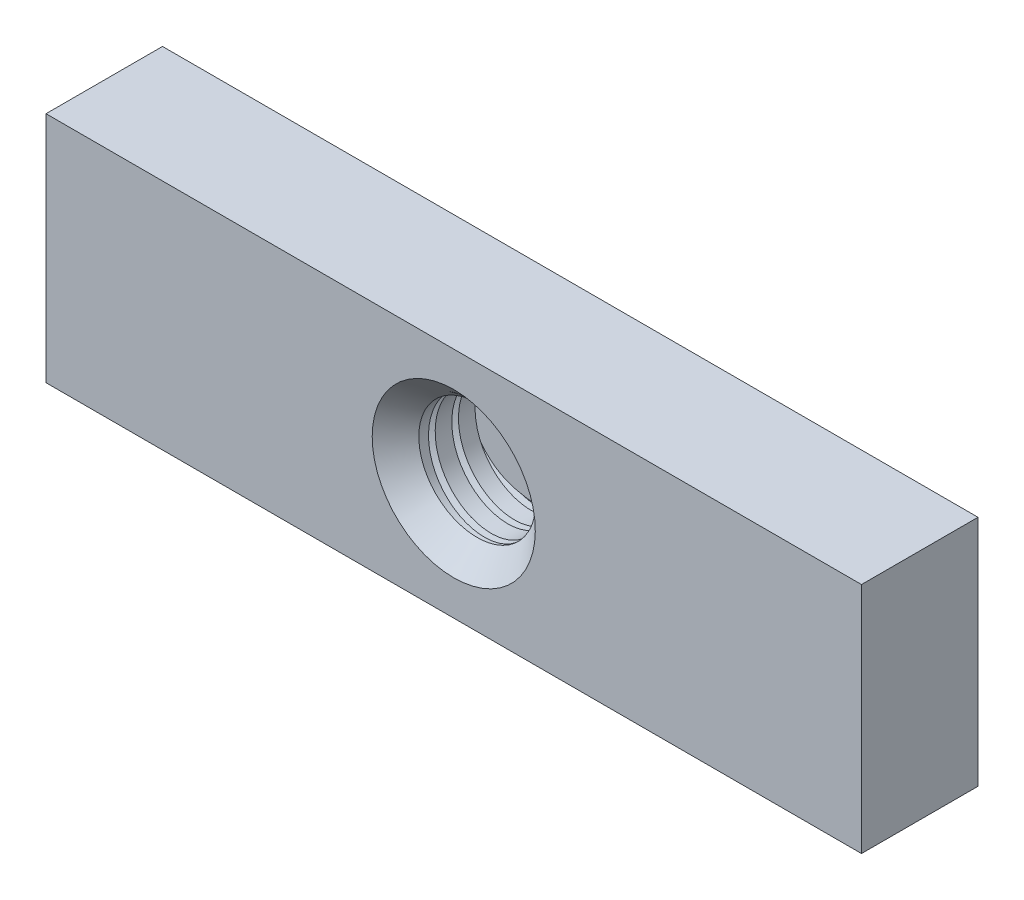
from build123d import *

# Parameters (mm, degrees)
SKETCH1_W           = 70
SKETCH1_H           = 20
SKETCH1_R           = 5
BOSS_EXTRUDE1_DEPTH = 7
CHAMFER1_SIZE       = 2
CUT_SWEEP2_PITCH    = 2
SKETCH4_W           = 70
SKETCH4_H           = 20
BOSS_EXTRUDE2_DEPTH = 3


with BuildPart() as part:
    # Sketch1 → Boss-Extrude1 (new body)
    with BuildSketch(Plane.XY):
        with Locations((35, 10)):
            Rectangle(SKETCH1_W, SKETCH1_H)
        with Locations((35, 10)):
            Circle(SKETCH1_R, mode=Mode.SUBTRACT)
    extrude(amount=BOSS_EXTRUDE1_DEPTH)

    # Chamfer1
    chamfer1_edges = [part.edges().sort_by_distance(p)[0] for p in [
        (30, 10, 7),
    ]]
    chamfer(chamfer1_edges, length=CHAMFER1_SIZE)

    # Cut-Sweep2: the profile of Sketch3 screwed along a right-hand helix of 7 turns, 10 arcs to a turn; built about Z, then put on its axis
    cut_sweep2_z = Axis((0, 0, 0), (0, 0, 1))
    cut_sweep2_corners = [(3.996838686, -0.020755165, 0.260817099), (5.496838686, -0.0894541, 1.124113373), (3.996838686, -0.158153035, 1.987409647)]
    with BuildLine(mode=Mode.PRIVATE) as cut_sweep2_profile:
        Line(cut_sweep2_corners[0], cut_sweep2_corners[1])
        Line(cut_sweep2_corners[1], cut_sweep2_corners[2])
        Line(cut_sweep2_corners[2], cut_sweep2_corners[0])
    cut_sweep2_cap = Face(cut_sweep2_profile.wire())
    cut_sweep2_turn_angles = [0, 18, 36, 54, 72, 90, 108, 126, 144, 162, 180, 198, 216, 234, 252, 270, 288, 306, 324, 342, 360]
    cut_sweep2_turn_weights = [1, 0.9510565162951535, 1, 0.9510565162951535, 1, 0.9510565162951535, 1, 0.9510565162951535, 1, 0.9510565162951535, 1, 0.9510565162951535, 1, 0.9510565162951535, 1, 0.9510565162951535, 1, 0.9510565162951535, 1, 0.9510565162951535, 1]
    cut_sweep2_turn_rails = [Edge.make_bspline([Vector(p[0], p[1], 0).rotate(cut_sweep2_z, cut_sweep2_turn_angles[k]) / cut_sweep2_turn_weights[k] + Vector(0, 0, p[2] + CUT_SWEEP2_PITCH * cut_sweep2_turn_angles[k] / 360) for k in range(21)], [0, 0, 0, 1, 1, 2, 2, 3, 3, 4, 4, 5, 5, 6, 6, 7, 7, 8, 8, 9, 9, 10, 10, 10], 2, cut_sweep2_turn_weights) for p in cut_sweep2_corners]
    cut_sweep2_turn_sides = [Face.make_surface_from_curves(cut_sweep2_turn_rails[p[0]], cut_sweep2_turn_rails[p[1]]) for p in [(0, 1), (1, 2), (2, 0)]]
    cut_sweep2 = Plane(origin=(35, 10, 7), x_dir=(-1, 0, 0), z_dir=(0, 0, -1)) * Solid(Shell([*[p.moved(Location((0, 0, CUT_SWEEP2_PITCH * i))) for i in range(7) for p in cut_sweep2_turn_sides], cut_sweep2_cap, cut_sweep2_cap.rotate(cut_sweep2_z, 2520).moved(Location((0, 0, CUT_SWEEP2_PITCH * 2520 / 360)))]))
    add(cut_sweep2, mode=Mode.SUBTRACT)

    # Sketch4 → Boss-Extrude2 (add)
    with BuildSketch(Plane(origin=(0, 0, 0), x_dir=(-1, 0, 0), z_dir=(0, 0, -1))):
        with Locations((-35, 10)):
            Rectangle(SKETCH4_W, SKETCH4_H)
    extrude(amount=BOSS_EXTRUDE2_DEPTH)


solid = part.part
